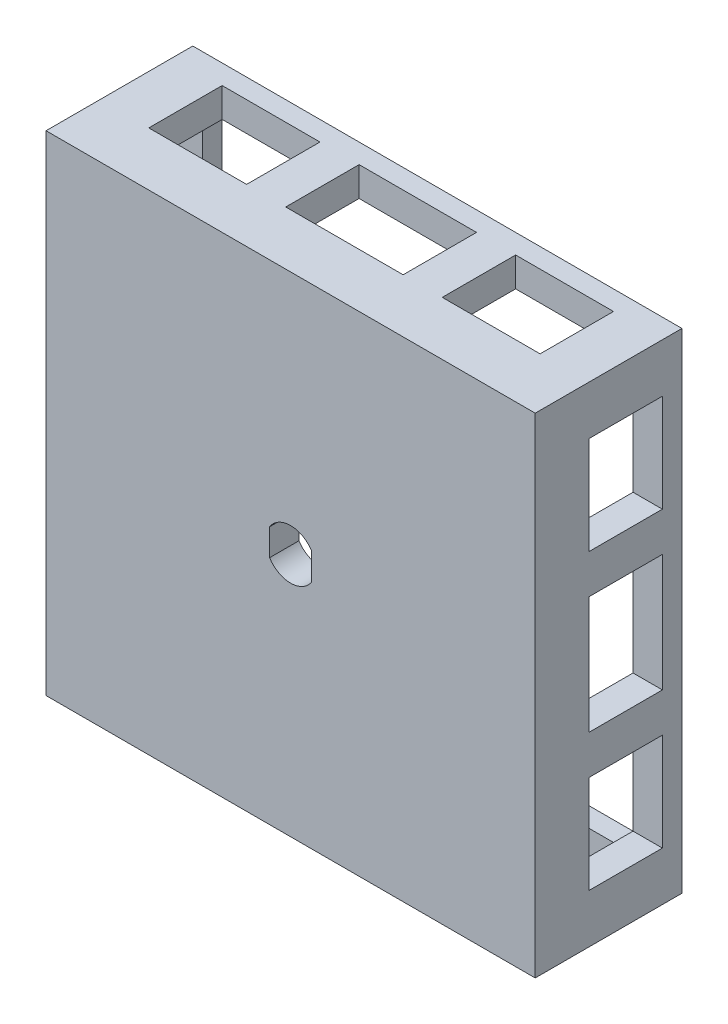
from build123d import *

# Parameters (mm, degrees)
SKETCH1_W               = 50
SKETCH1_H               = 50
BOSS_EXTRUDE1_DEPTH     = 15
SHELL1_T                = -3
CUT_EXTRUDE1_DEPTH      = 39.405728739
CUT_EXTRUDE1_DEPTH_BACK = 39.405728739
CUT_EXTRUDE2_DEPTH      = 58.879184514
CUT_EXTRUDE2_DEPTH_BACK = 58.879184514
SKETCH5_W               = 7.5
SKETCH5_H               = 10
SKETCH5_H_2             = 12
CUT_EXTRUDE3_DEPTH      = 58.879184514
CUT_EXTRUDE3_DEPTH_BACK = 58.879184514
SKETCH6_W               = 12
SKETCH6_H               = 7.5
SKETCH6_W_2             = 10


with BuildPart() as part:
    # Sketch1 → Boss-Extrude1 (new body)
    with BuildSketch(Plane.XY):
        Rectangle(SKETCH1_W, SKETCH1_H)
    extrude(amount=BOSS_EXTRUDE1_DEPTH)

    # Shell1
    shell1_openings = [part.faces().sort_by_distance(p)[0] for p in [
        (0, 0, 0),
    ]]
    offset(amount=SHELL1_T, openings=shell1_openings, kind=Kind.INTERSECTION)

    # Sketch2 → Cut-Extrude1 (cut, two sides: drawn at the far end of the back side and taken through both)
    with BuildSketch(Plane(origin=(0, 0, 0), x_dir=(-1, 0, 0), z_dir=(0, 0, -1)).offset(-CUT_EXTRUDE1_DEPTH_BACK)):
        with BuildLine():
            Line((-2.15, 1.37113092), (-2.15, -1.37113092))
            ThreePointArc((-2.15, -1.37113092), (0, -2.55), (2.15, -1.37113092))
            Line((2.15, -1.37113092), (2.15, 1.37113092))
            ThreePointArc((2.15, 1.37113092), (0, 2.55), (-2.15, 1.37113092))
        make_face()
    extrude(amount=CUT_EXTRUDE1_DEPTH + CUT_EXTRUDE1_DEPTH_BACK, mode=Mode.SUBTRACT)

    # Sketch5 → Cut-Extrude2 (cut, two sides: drawn at the far end of the back side and taken through both)
    with BuildSketch(Plane.ZY.offset(25).offset(-CUT_EXTRUDE2_DEPTH_BACK)):
        with Locations((5.75, 15)):
            Rectangle(SKETCH5_W, SKETCH5_H)
        with Locations((5.75, 0)):
            Rectangle(SKETCH5_W, SKETCH5_H_2)
        with Locations((5.75, -15)):
            Rectangle(SKETCH5_W, SKETCH5_H)
    extrude(amount=CUT_EXTRUDE2_DEPTH + CUT_EXTRUDE2_DEPTH_BACK, mode=Mode.SUBTRACT)

    # Sketch6 → Cut-Extrude3 (cut, two sides: drawn at the far end of the back side and taken through both)
    with BuildSketch(Plane.XZ.offset(25).offset(-CUT_EXTRUDE3_DEPTH_BACK)):
        with Locations((0, 5.75)):
            Rectangle(SKETCH6_W, SKETCH6_H)
        with Locations((15, 5.75)):
            Rectangle(SKETCH6_W_2, SKETCH6_H)
        with Locations((-15, 5.75)):
            Rectangle(SKETCH6_W_2, SKETCH6_H)
    extrude(amount=CUT_EXTRUDE3_DEPTH + CUT_EXTRUDE3_DEPTH_BACK, mode=Mode.SUBTRACT)


solid = part.part
